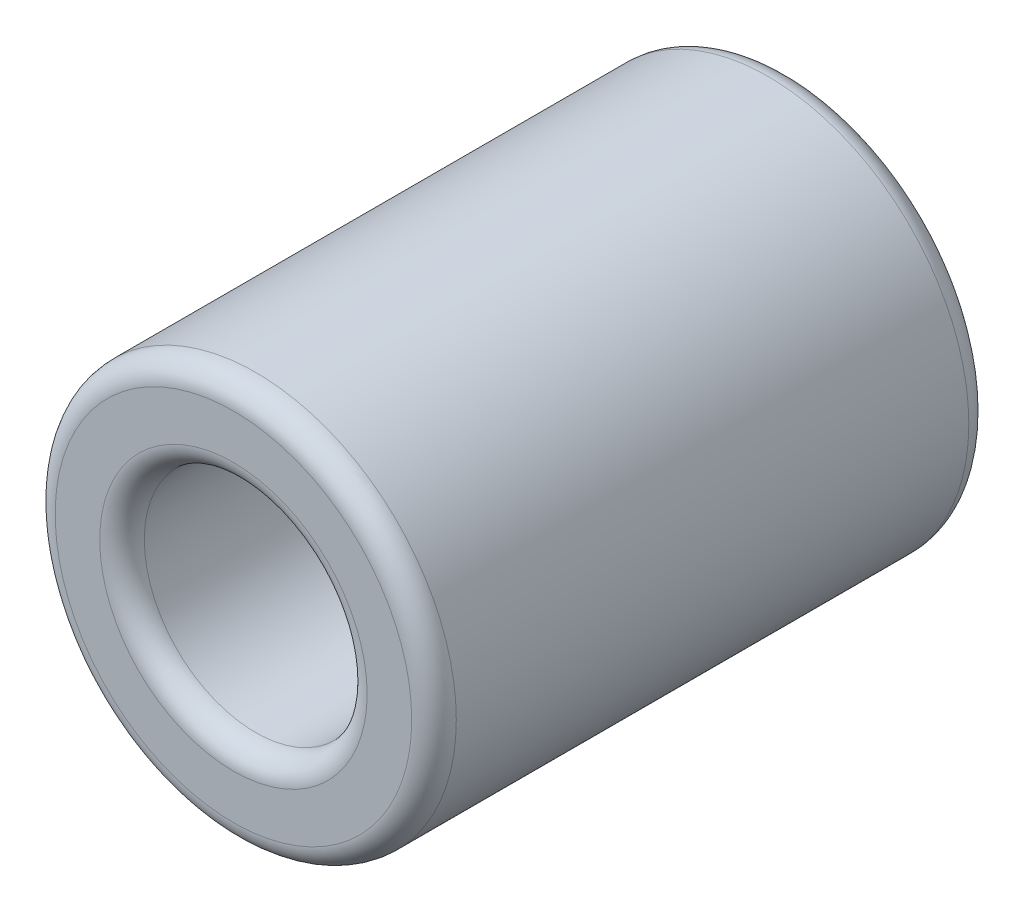
from build123d import *

# Parameters (mm, degrees)
SZKIC1_R                    = 9
SZKIC1_R_2                  = 5
DODANIE_WYCI_GNI_CIE1_DEPTH = 25
ZAOKR_GLENIE1_R             = 1


with BuildPart() as part:
    # Szkic1 → Dodanie-wyciągnięcie1 (new body)
    with BuildSketch(Plane.XY):
        Circle(SZKIC1_R)
        Circle(SZKIC1_R_2, mode=Mode.SUBTRACT)
    extrude(amount=DODANIE_WYCI_GNI_CIE1_DEPTH)

    # Zaokrąglenie1
    zaokr_glenie1_edges = [part.edges().sort_by_distance(p)[0] for p in [
        (-5, 0, 0),
        (-9, 0, 0),
        (-5, 0, 25),
        (-9, 0, 25),
    ]]
    fillet(zaokr_glenie1_edges, radius=ZAOKR_GLENIE1_R)


solid = part.part
